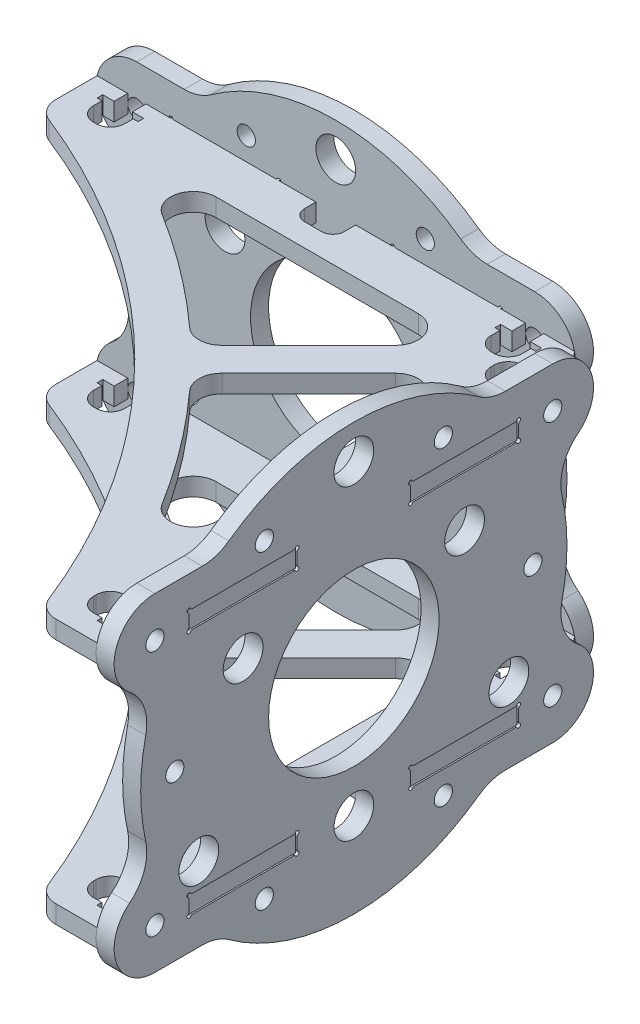
from build123d import *

# Parameters (mm, degrees)
STOCK_TRANSMISSION_MASTER_1_START           = 4.175
STOCK_TRANSMISSION_MASTER_1_OUTLINE_R       = 37.5
STOCK_TRANSMISSION_MASTER_1_OUTLINE_R_2     = 1.6
STOCK_TRANSMISSION_MASTER_1_OUTLINE_R_3     = 3.5
STOCK_TRANSMISSION_MASTER_1_OUTLINE_R_4     = 15
STOCK_TRANSMISSION_MASTER_1_DEPTH           = 3.175
INTERFACE_START                             = -3.175
SKETCH2_R                                   = 1.6
INTERFACE_GUSSET_HOLES_DEPTH                = 3.175
INTERFACE_FILLET_R                          = 8
SKETCH3_W                                   = 19
SKETCH3_H                                   = 3.175
INTERFACE_SLOTS_DEPTH                       = 57.526928062
INTERFACE_SLOTS_TRYNA_MAKE_A_PRESS_FIT_BY   = 0.005
INTERFACE_SLOTS_TRYNA_MAKE_A_PRESS_FIT_2_BY = 0.005
INTERFACE_SLOTS_TRYNA_MAKE_A_PRESS_F_2_BY   = 0.005
INTERFACE_SLOTS_TRYNA_MAKE_A_PRESS_F_2_2_BY = 0.005
SKETCH10_R                                  = 0.35
INTERFACE_SLOTS_KERF_CORNER_RELIEFS_DEPTH   = 57.526928062
INTERFACE_SLOTS_KERF_CORNER_FILLET_R        = 0.3
INTERFACE_FILLET_OF_INTERFACE_MIRROR_R      = 8
INTERFACE_SLOTS_KERF_CORNER_FILLET_OF_IN_R  = 0.3
INTERFACE_COPY_ANGLE                        = 90
GUSSET_START                                = 20.1098
SKETCH4_W                                   = 19
SKETCH4_H                                   = 2.921
GUSSET_EXTRUDE_DEPTH                        = 3.165
SKETCH6_W                                   = 3.2
SKETCH6_H                                   = 2.4
SKETCH6_H_2                                 = 1
SKETCH6_W_2                                 = 1.15
SKETCH6_W_3                                 = 0.85
GUSSET_RIVET_T_NUT_THINGS_DEPTH             = 122.585023376
GUSSET_LIGHTENING_DEPTH                     = 122.585023376
SKETCH11_W                                  = 7
SKETCH11_H                                  = 4
SKETCH11_W_2                                = 4
SKETCH11_H_2                                = 7
GUSSET_SCREW_CLEARANCE_DEPTH                = 122.585023376
GUSSET_SCREW_CLEARANCE_FILLET_R             = 2
GUSSET_LIGHTENING_FILLET_R                  = 4
GUSSET_CORNER_FILLET_R                      = 4


# Read off the part's stored shape, not the designer's step: Stock-_transmission_master-1
with BuildPart() as part:
    # Stock-_transmission_master-1 outline → Stock-_transmission_master-1 (new body)
    with BuildSketch(Plane.XY.offset(STOCK_TRANSMISSION_MASTER_1_START)):
        Circle(STOCK_TRANSMISSION_MASTER_1_OUTLINE_R)
        with Locations((-15.75, -27.279800219)):
            Circle(STOCK_TRANSMISSION_MASTER_1_OUTLINE_R_2, mode=Mode.SUBTRACT)
        with Locations((-27.279800219, -15.75)):
            Circle(STOCK_TRANSMISSION_MASTER_1_OUTLINE_R_3, mode=Mode.SUBTRACT)
        with Locations((0, -22.5)):
            Circle(STOCK_TRANSMISSION_MASTER_1_OUTLINE_R_3, mode=Mode.SUBTRACT)
        with Locations((15.75, -27.279800219)):
            Circle(STOCK_TRANSMISSION_MASTER_1_OUTLINE_R_2, mode=Mode.SUBTRACT)
        with Locations((27.279800219, -15.75)):
            Circle(STOCK_TRANSMISSION_MASTER_1_OUTLINE_R_3, mode=Mode.SUBTRACT)
        with Locations((-31.5, 0)):
            Circle(STOCK_TRANSMISSION_MASTER_1_OUTLINE_R_2, mode=Mode.SUBTRACT)
        with Locations((-19.485571585, 11.25)):
            Circle(STOCK_TRANSMISSION_MASTER_1_OUTLINE_R_3, mode=Mode.SUBTRACT)
        with Locations((-15.75, 27.279800219)):
            Circle(STOCK_TRANSMISSION_MASTER_1_OUTLINE_R_2, mode=Mode.SUBTRACT)
        Circle(STOCK_TRANSMISSION_MASTER_1_OUTLINE_R_4, mode=Mode.SUBTRACT)
        with Locations((31.5, 0)):
            Circle(STOCK_TRANSMISSION_MASTER_1_OUTLINE_R_2, mode=Mode.SUBTRACT)
        with Locations((19.485571585, 11.25)):
            Circle(STOCK_TRANSMISSION_MASTER_1_OUTLINE_R_3, mode=Mode.SUBTRACT)
        with Locations((15.75, 27.279800219)):
            Circle(STOCK_TRANSMISSION_MASTER_1_OUTLINE_R_2, mode=Mode.SUBTRACT)
        with Locations((0, 31.5)):
            Circle(STOCK_TRANSMISSION_MASTER_1_OUTLINE_R_3, mode=Mode.SUBTRACT)
    extrude(amount=STOCK_TRANSMISSION_MASTER_1_DEPTH)

    # Sketch2 → interface gusset holes (add)
    # profile 1 of 2: a face of its own
    with BuildSketch(Plane.XY.offset(7.35).offset(INTERFACE_START)):
        with BuildLine():
            Line((-23.932612775, 28.870054482), (-35, 28.870054482))
            ThreePointArc((-35, 28.870054482), (-42.174556997, 21.478085019), (-34.571760441, 14.527332171))
            ThreePointArc((-34.571760441, 14.527332171), (-30.118413673, 22.341243426), (-23.932612775, 28.870054482))
        make_face()
        with Locations((-35, 21.692300219)):
            Circle(SKETCH2_R, mode=Mode.SUBTRACT)
    # profile 2 of 2: a face of its own
    with BuildSketch(Plane.XY.offset(7.35).offset(INTERFACE_START)):
        with BuildLine():
            Line((35, 28.870054482), (23.932612775, 28.870054482))
            ThreePointArc((23.932612775, 28.870054482), (30.118413673, 22.341243426), (34.571760441, 14.527332171))
            ThreePointArc((34.571760441, 14.527332171), (42.174556997, 21.478085019), (35, 28.870054482))
        make_face()
        with Locations((35, 21.692300219)):
            Circle(SKETCH2_R, mode=Mode.SUBTRACT)
    interface_gusset_holes = extrude(amount=INTERFACE_GUSSET_HOLES_DEPTH)

    # interface fillet
    interface_fillet_edges = [part.edges().sort_by_distance(p)[0] for p in [
        (-34.571760441, 14.527332171, 5.7625),
        (-23.932612775, 28.870054482, 5.7625),
        (34.571760441, 14.527332171, 5.7625),
        (23.932612775, 28.870054482, 5.7625),
    ]]
    fillet(interface_fillet_edges, radius=INTERFACE_FILLET_R)

    # Sketch3 → interface slots (cut, through all)
    with BuildSketch(Plane.XY.offset(7.35)):
        with Locations((-19.5, 21.692300219)):
            Rectangle(SKETCH3_W, SKETCH3_H)
        with Locations((19.5, 21.692300219)):
            Rectangle(SKETCH3_W, SKETCH3_H)
    interface_slots = extrude(amount=-INTERFACE_SLOTS_DEPTH, mode=Mode.SUBTRACT)

    # interface slots tryna make a press fit: a face moved outward by 0.005
    extrude(part.faces().sort_by_distance((19.5, 20.104800219, 5.7625))[0], amount=INTERFACE_SLOTS_TRYNA_MAKE_A_PRESS_FIT_BY, dir=(0, 1, 0))

    # interface slots tryna make a press fit 2: a face moved outward by 0.005
    extrude(part.faces().sort_by_distance((-19.5, 20.104800219, 5.7625))[0], amount=INTERFACE_SLOTS_TRYNA_MAKE_A_PRESS_FIT_2_BY, dir=(0, 1, 0))

    # interface slots tryna make a press f 2: a face moved outward by 0.005
    extrude(part.faces().sort_by_distance((-19.5, 23.279800219, 5.7625))[0], amount=INTERFACE_SLOTS_TRYNA_MAKE_A_PRESS_F_2_BY, dir=(0, -1, 0))

    # interface slots tryna make a press f 2 2: a face moved outward by 0.005
    extrude(part.faces().sort_by_distance((19.5, 23.279800219, 5.7625))[0], amount=INTERFACE_SLOTS_TRYNA_MAKE_A_PRESS_F_2_2_BY, dir=(0, -1, 0))

    # Sketch10 → interface slots kerf corner reliefs (cut, through all)
    with BuildSketch(Plane.XY.offset(7.35)):
        with Locations((-29, 23.274800219)):
            Circle(SKETCH10_R)
        with Locations((-29, 20.109800219)):
            Circle(SKETCH10_R)
        with Locations((-10, 20.109800219)):
            Circle(SKETCH10_R)
        with Locations((-10, 23.274800219)):
            Circle(SKETCH10_R)
        with Locations((10, 23.274800219)):
            Circle(SKETCH10_R)
        with Locations((10, 20.109800219)):
            Circle(SKETCH10_R)
        with Locations((29, 23.274800219)):
            Circle(SKETCH10_R)
        with Locations((29, 20.109800219)):
            Circle(SKETCH10_R)
    interface_slots_kerf_corner_reliefs = extrude(amount=-INTERFACE_SLOTS_KERF_CORNER_RELIEFS_DEPTH, mode=Mode.SUBTRACT)

    # interface slots kerf corner fillet
    interface_slots_kerf_corner_fillet_edges = [part.edges().sort_by_distance(p)[0] for p in [
        (-10.35, 20.109800219, 5.7625),
        (-28.65, 20.109800219, 5.7625),
        (-10, 22.924800219, 5.7625),
        (-28.65, 23.274800219, 5.7625),
        (10.35, 20.109800219, 5.7625),
        (28.65, 20.109800219, 5.7625),
        (29, 22.924800219, 5.7625),
        (10.35, 23.274800219, 5.7625),
        (-29, 20.459800219, 5.7625),
        (-10, 20.459800219, 5.7625),
        (-10.35, 23.274800219, 5.7625),
        (10, 22.924800219, 5.7625),
        (29, 20.459800219, 5.7625),
        (28.65, 23.274800219, 5.7625),
        (10, 20.459800219, 5.7625),
        (-29, 22.924800219, 5.7625),
    ]]
    fillet(interface_slots_kerf_corner_fillet_edges, radius=INTERFACE_SLOTS_KERF_CORNER_FILLET_R)

    # interface mirror: interface gusset holes, interface slots, interface slots kerf corner reliefs across plane
    add(interface_gusset_holes.mirror(Plane.ZX))
    add(interface_slots.mirror(Plane.ZX), mode=Mode.SUBTRACT)
    add(interface_slots_kerf_corner_reliefs.mirror(Plane.ZX), mode=Mode.SUBTRACT)

    # interface fillet of interface mirror
    interface_fillet_of_interface_mirror_edges = [part.edges().sort_by_distance(p)[0] for p in [
        (-34.571760441, -14.527332171, 5.7625),
        (-23.932612775, -28.870054482, 5.7625),
        (34.571760441, -14.527332171, 5.7625),
        (23.932612775, -28.870054482, 5.7625),
    ]]
    fillet(interface_fillet_of_interface_mirror_edges, radius=INTERFACE_FILLET_OF_INTERFACE_MIRROR_R)

    # interface slots kerf corner fillet of in
    interface_slots_kerf_corner_fillet_of_in_edges = [part.edges().sort_by_distance(p)[0] for p in [
        (-10.35, -20.109800219, 5.7625),
        (-28.65, -20.109800219, 5.7625),
        (-10, -22.924800219, 5.7625),
        (-28.65, -23.274800219, 5.7625),
        (10.35, -20.109800219, 5.7625),
        (28.65, -20.109800219, 5.7625),
        (29, -22.924800219, 5.7625),
        (10.35, -23.274800219, 5.7625),
        (-29, -20.459800219, 5.7625),
        (-10, -20.459800219, 5.7625),
        (-10.35, -23.274800219, 5.7625),
        (10, -22.924800219, 5.7625),
        (29, -20.459800219, 5.7625),
        (28.65, -23.274800219, 5.7625),
        (10, -20.459800219, 5.7625),
        (-29, -22.924800219, 5.7625),
    ]]
    fillet(interface_slots_kerf_corner_fillet_of_in_edges, radius=INTERFACE_SLOTS_KERF_CORNER_FILLET_OF_IN_R)


with BuildPart() as body_2:
    # interface copy: copy of part
    add(part.part.rotate(Axis((0, 0, 5.7625), (0, -1, 0)), INTERFACE_COPY_ANGLE))


with BuildPart() as body_2_1:
    # interface translate: moved
    add(body_2.part.moved(Location((46, 0, 46))))


with BuildPart() as body_3:
    # Sketch4 → gusset extrude (new body)
    with BuildSketch(Plane(origin=(0, 0, 0), x_dir=(1, 0, 0), z_dir=(0, 1, 0)).offset(GUSSET_START)):
        Polygon((44.4125, -7.35), (29, -7.35), (10, -7.35), (-10, -7.35), (-29, -7.35), (-42, -7.35), (-42, -17.35), (-3.79375, -55.55625), align=None)
        with Locations((19.5, -5.8895)):
            Rectangle(SKETCH4_W, SKETCH4_H)
        with Locations((-19.5, -5.8895)):
            Rectangle(SKETCH4_W, SKETCH4_H)
    extrude(amount=GUSSET_EXTRUDE_DEPTH)

    # Sketch6 → gusset rivet t-nut things (cut, through all)
    with BuildSketch(Plane(origin=(0, 23.274800219, 0), x_dir=(1, 0, 0), z_dir=(0, 1, 0))):
        with Locations((35, -8.55)):
            Rectangle(SKETCH6_W, SKETCH6_H)
        with Locations((35, -10.25)):
            Rectangle(SKETCH6_W, SKETCH6_H_2)
        with Locations((32.825, -10.25)):
            Rectangle(SKETCH6_W_2, SKETCH6_H_2)
        with Locations((37.175, -10.25)):
            Rectangle(SKETCH6_W_2, SKETCH6_H_2)
        with Locations((38.175, -10.25)):
            Rectangle(SKETCH6_W_3, SKETCH6_H_2)
        with BuildLine():
            Line((37.75, -10.75), (36.6, -10.75))
            Line((36.6, -10.75), (36.6, -14.354162541))
            ThreePointArc((36.6, -14.354162541), (37.443741097, -13.448957881), (37.75, -12.25))
            Line((37.75, -12.25), (37.75, -10.75))
        make_face()
        with BuildLine():
            Line((36.6, -10.75), (33.4, -10.75))
            Line((33.4, -10.75), (33.4, -14.354162541))
            ThreePointArc((33.4, -14.354162541), (34.046582042, -14.649000454), (34.75, -14.75))
            Line((34.75, -14.75), (35.25, -14.75))
            ThreePointArc((35.25, -14.75), (35.953417958, -14.649000454), (36.6, -14.354162541))
            Line((36.6, -14.354162541), (36.6, -10.75))
        make_face()
        with BuildLine():
            Line((33.4, -10.75), (32.25, -10.75))
            Line((32.25, -10.75), (32.25, -12.25))
            ThreePointArc((32.25, -12.25), (32.556258903, -13.448957881), (33.4, -14.354162541))
            Line((33.4, -14.354162541), (33.4, -10.75))
        make_face()
        with Locations((31.825, -10.25)):
            Rectangle(SKETCH6_W_3, SKETCH6_H_2)
        with Locations((-35, -8.55)):
            Rectangle(SKETCH6_W, SKETCH6_H)
        with Locations((-38.175, -10.25)):
            Rectangle(SKETCH6_W_3, SKETCH6_H_2)
        with Locations((-37.175, -10.25)):
            Rectangle(SKETCH6_W_2, SKETCH6_H_2)
        with Locations((-35, -10.25)):
            Rectangle(SKETCH6_W, SKETCH6_H_2)
        with Locations((-32.825, -10.25)):
            Rectangle(SKETCH6_W_2, SKETCH6_H_2)
        with Locations((-31.825, -10.25)):
            Rectangle(SKETCH6_W_3, SKETCH6_H_2)
        with BuildLine():
            Line((-32.25, -10.75), (-33.4, -10.75))
            Line((-33.4, -10.75), (-33.4, -14.354162541))
            ThreePointArc((-33.4, -14.354162541), (-32.556258903, -13.448957881), (-32.25, -12.25))
            Line((-32.25, -12.25), (-32.25, -10.75))
        make_face()
        with BuildLine():
            Line((-33.4, -10.75), (-36.6, -10.75))
            Line((-36.6, -10.75), (-36.6, -14.354162541))
            ThreePointArc((-36.6, -14.354162541), (-35.953417958, -14.649000454), (-35.25, -14.75))
            Line((-35.25, -14.75), (-34.75, -14.75))
            ThreePointArc((-34.75, -14.75), (-34.046582042, -14.649000454), (-33.4, -14.354162541))
            Line((-33.4, -14.354162541), (-33.4, -10.75))
        make_face()
        with BuildLine():
            Line((-36.6, -14.354162541), (-36.6, -10.75))
            Line((-36.6, -10.75), (-37.75, -10.75))
            Line((-37.75, -10.75), (-37.75, -12.25))
            ThreePointArc((-37.75, -12.25), (-37.443741097, -13.448957881), (-36.6, -14.354162541))
        make_face()
    extrude(amount=-GUSSET_RIVET_T_NUT_THINGS_DEPTH, mode=Mode.SUBTRACT)


with BuildPart() as body_4:
    # gusset half mirror: mirrored copy
    add(body_3.part.mirror(Plane(origin=(9.29375, 123.67956031, 42.46875), x_dir=(-0.7071067811865509, 0, 0.7071067811865441), z_dir=(0.7071067811865444, 0, 0.7071067811865508))))


with BuildPart() as body_3_1:
    add(body_3.part)

    # gusset merge: union body 4
    add(body_4.part)

    # Sketch8 → gusset lightening (cut, through all)
    with BuildSketch(Plane(origin=(0, 23.274800219, 0), x_dir=(1, 0, 0), z_dir=(0, 1, 0))):
        with BuildLine():
            ThreePointArc((-42, -17.35), (4.522222473, -47.240277527), (34.4125, -93.7625))
            Line((34.4125, -93.7625), (-42, -17.35))
        make_face()
        with BuildLine():
            Line((32.169859313, -15.35), (-28.758210931, -15.35))
            ThreePointArc((-28.758210931, -15.35), (-9.715873521, -26.319492739), (7.327550617, -40.192563004))
            ThreePointArc((7.327550617, -40.192563004), (7.339068145, -40.180854746), (7.350649598, -40.169209715))
            Line((7.350649598, -40.169209715), (32.169859313, -15.35))
        make_face()
        with BuildLine():
            ThreePointArc((11.593290285, -44.411850402), (11.581645254, -44.423431855), (11.569936996, -44.434949383))
            ThreePointArc((11.569936996, -44.434949383), (25.443007261, -61.478373521), (36.4125, -80.520710931))
            Line((36.4125, -80.520710931), (36.4125, -19.592640687))
            Line((36.4125, -19.592640687), (11.593290285, -44.411850402))
        make_face()
        with BuildLine():
            Line((44.4125, -7.35), (42, -7.35))
            ThreePointArc((42, -7.35), (43.137435571, -8.625064429), (44.4125, -9.7625))
            Line((44.4125, -9.7625), (44.4125, -7.35))
        make_face()
    extrude(amount=-GUSSET_LIGHTENING_DEPTH, mode=Mode.SUBTRACT)

    # Sketch11 → gusset screw clearance (cut, through all)
    with BuildSketch(Plane(origin=(0, 23.274800219, 0), x_dir=(1, 0, 0), z_dir=(0, 1, 0))):
        with Locations((0, -9.35)):
            Rectangle(SKETCH11_W, SKETCH11_H)
        with Locations((42.4125, -51.7625)):
            Rectangle(SKETCH11_W_2, SKETCH11_H_2)
    extrude(amount=-GUSSET_SCREW_CLEARANCE_DEPTH, mode=Mode.SUBTRACT)

    # gusset screw clearance fillet
    gusset_screw_clearance_fillet_edges = [body_3_1.edges().sort_by_distance(p)[0] for p in [
        (3.5, 21.69230011, 11.35),
        (-3.5, 21.69230011, 11.35),
        (40.4125, 21.69230011, 55.2625),
        (40.4125, 21.69230011, 48.2625),
    ]]
    fillet(gusset_screw_clearance_fillet_edges, radius=GUSSET_SCREW_CLEARANCE_FILLET_R)

    # gusset lightening fillet
    gusset_lightening_fillet_edges = [body_3_1.edges().sort_by_distance(p)[0] for p in [
        (36.4125, 21.69230011, 80.520710931),
        (7.327550617, 21.69230011, 40.192563004),
        (11.569936996, 21.69230011, 44.434949383),
        (-28.758210931, 21.69230011, 15.35),
    ]]
    fillet(gusset_lightening_fillet_edges, radius=GUSSET_LIGHTENING_FILLET_R)

    # gusset corner fillet
    gusset_corner_fillet_edges = [body_3_1.edges().sort_by_distance(p)[0] for p in [
        (34.4125, 21.6923, 93.7625),
        (32.169859313, 21.69230011, 15.35),
        (36.4125, 21.69230011, 19.592640687),
        (-42, 21.6923, 17.35),
    ]]
    fillet(gusset_corner_fillet_edges, radius=GUSSET_CORNER_FILLET_R)


with BuildPart() as body_4_2:
    # gusset mirror: mirrored copy
    add(body_3_1.part.mirror(Plane.ZX))


solid = Compound([part.part, body_2_1.part, body_3_1.part, body_4_2.part])
